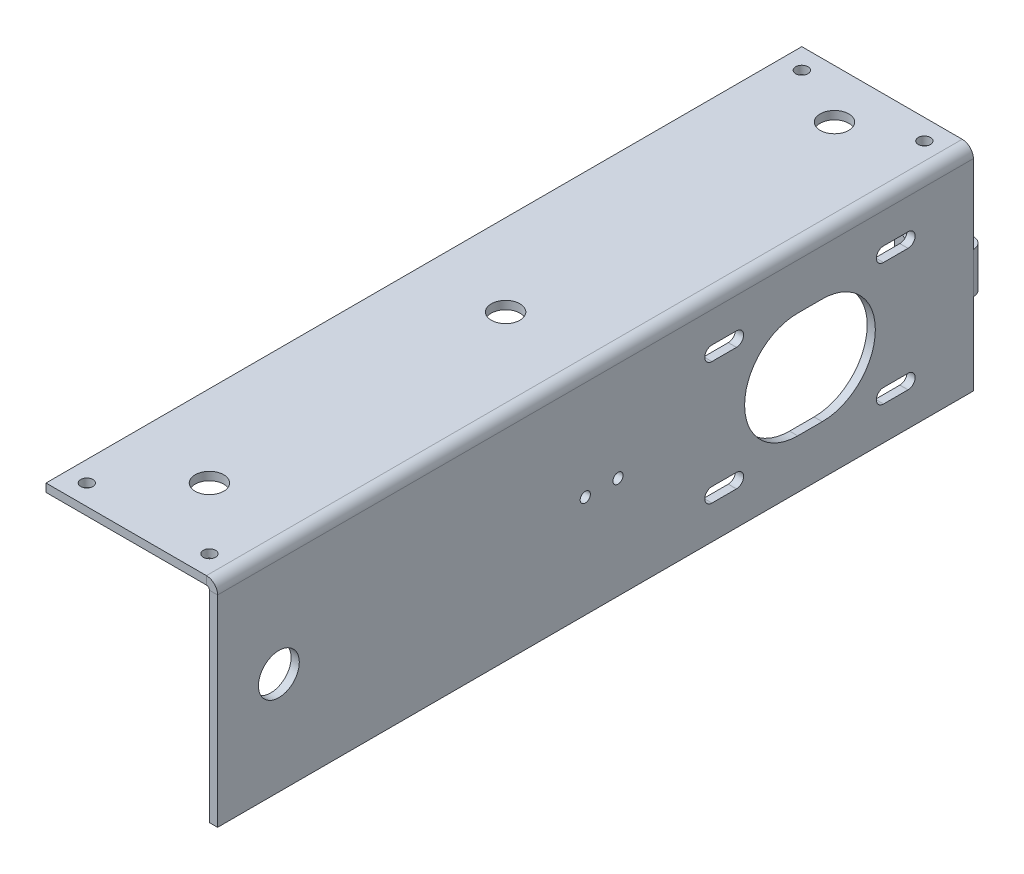
from build123d import *

# Parameters (mm, degrees)
SM_BASE_FLANGE_1_DEPTH    = 185
CUT_EXTRUDE_1_REACH       = 197.768
SKETCH_6_R                = 5
SM_EDGE_FLANGE_1_DEPTH    = 49.2634
HOLE_WIZARD_M3_2_D        = 3
CUT_EXTRUDE_START         = -2.7366
CUT_EXTRUDE_6_OUTLINE_W   = 21
CUT_EXTRUDE_6_OUTLINE_H   = 20
CUT_EXTRUDE_6_OUTLINE_H_2 = 19.2634
CUT_EXTRUDE_6_DEPTH       = 2.7366
HOLE_WIZARD_3_5_3_5_1_D   = 3.5
HOLE_WIZARD_7_0_7_1_D     = 7
HOLE_WIZARD_7_0_7_1_DEPTH = 6
HOLE_WIZARD_7_0_7_1_TIP   = 2.103012167
M3X0_5_1_D                = 2.5


# Read off the part's stored shape, not the designer's step: 除料-伸長6
# Sheet-metal steps are written as plain solids
with BuildPart() as part:
    # Sketch 1 → 基材-凸緣1 (new body)
    with BuildSketch(Plane.XY):
        with BuildLine():
            Line((0, -50), (0, -0.7366))
            ThreePointArc((0, -0.7366), (-0.215745145, -0.215745145), (-0.7366, 0))
            Line((-0.7366, 0), (-40, 0))
            Line((-40, 0), (-40, 2))
            Line((-40, 2), (-0.7366, 2))
            ThreePointArc((-0.7366, 2), (1.198468417, 1.198468417), (2, -0.7366))
            Line((2, -0.7366), (2, -50))
            Line((2, -50), (0, -50))
        make_face()
    extrude(amount=SM_BASE_FLANGE_1_DEPTH)

    # 草圖6 → 除料-伸長1 (cut, up to next)
    with BuildSketch(Plane.ZY, mode=Mode.PRIVATE) as cut_extrude_1_sk1:
        with Locations(Location((170, -25, 0), (0, 0, 270))):
            Circle(SKETCH_6_R)
    cut_extrude_1_tool1 = extrude(cut_extrude_1_sk1.sketch, amount=-CUT_EXTRUDE_1_REACH, mode=Mode.PRIVATE) & part.part
    # 草圖6 → 除料-伸長1 (cut, up to next)
    with BuildSketch(Plane.ZY, mode=Mode.PRIVATE) as cut_extrude_1_sk2:
        with BuildLine():
            Line((37, -12), (43, -12))
            ThreePointArc((43, -12), (56, -25), (43, -38))
            Line((43, -38), (37, -38))
            ThreePointArc((37, -38), (24, -25), (37, -12))
        make_face()
    cut_extrude_1_tool2 = extrude(cut_extrude_1_sk2.sketch, amount=-CUT_EXTRUDE_1_REACH, mode=Mode.PRIVATE) & part.part
    # 草圖6 → 除料-伸長1 (cut, up to next)
    with BuildSketch(Plane.ZY, mode=Mode.PRIVATE) as cut_extrude_1_sk3:
        with BuildLine():
            Line((58, -8.25), (64, -8.25))
            ThreePointArc((64, -8.25), (65.75, -10), (64, -11.75))
            Line((64, -11.75), (58, -11.75))
            ThreePointArc((58, -11.75), (56.25, -10), (58, -8.25))
        make_face()
    cut_extrude_1_tool3 = extrude(cut_extrude_1_sk3.sketch, amount=-CUT_EXTRUDE_1_REACH, mode=Mode.PRIVATE) & part.part
    # 草圖6 → 除料-伸長1 (cut, up to next)
    with BuildSketch(Plane.ZY, mode=Mode.PRIVATE) as cut_extrude_1_sk4:
        with BuildLine():
            Line((16, -8.25), (22, -8.25))
            ThreePointArc((22, -8.25), (23.75, -10), (22, -11.75))
            Line((22, -11.75), (16, -11.75))
            ThreePointArc((16, -11.75), (14.25, -10), (16, -8.25))
        make_face()
    cut_extrude_1_tool4 = extrude(cut_extrude_1_sk4.sketch, amount=-CUT_EXTRUDE_1_REACH, mode=Mode.PRIVATE) & part.part
    # 草圖6 → 除料-伸長1 (cut, up to next)
    with BuildSketch(Plane.ZY, mode=Mode.PRIVATE) as cut_extrude_1_sk5:
        with BuildLine():
            Line((16, -38.25), (22, -38.25))
            ThreePointArc((22, -38.25), (23.75, -40), (22, -41.75))
            Line((22, -41.75), (16, -41.75))
            ThreePointArc((16, -41.75), (14.25, -40), (16, -38.25))
        make_face()
    cut_extrude_1_tool5 = extrude(cut_extrude_1_sk5.sketch, amount=-CUT_EXTRUDE_1_REACH, mode=Mode.PRIVATE) & part.part
    # 草圖6 → 除料-伸長1 (cut, up to next)
    with BuildSketch(Plane.ZY, mode=Mode.PRIVATE) as cut_extrude_1_sk6:
        with BuildLine():
            Line((58, -38.25), (64, -38.25))
            ThreePointArc((64, -38.25), (65.75, -40), (64, -41.75))
            Line((64, -41.75), (58, -41.75))
            ThreePointArc((58, -41.75), (56.25, -40), (58, -38.25))
        make_face()
    cut_extrude_1_tool6 = extrude(cut_extrude_1_sk6.sketch, amount=-CUT_EXTRUDE_1_REACH, mode=Mode.PRIVATE) & part.part
    add(cut_extrude_1_tool1.solids().sort_by_distance((0, -25, 170))[0], mode=Mode.SUBTRACT)
    add(cut_extrude_1_tool2.solids().sort_by_distance((0, -25, 40))[0], mode=Mode.SUBTRACT)
    add(cut_extrude_1_tool3.solids().sort_by_distance((0, -10, 61))[0], mode=Mode.SUBTRACT)
    add(cut_extrude_1_tool4.solids().sort_by_distance((0, -10, 19))[0], mode=Mode.SUBTRACT)
    add(cut_extrude_1_tool5.solids().sort_by_distance((0, -40, 19))[0], mode=Mode.SUBTRACT)
    add(cut_extrude_1_tool6.solids().sort_by_distance((0, -40, 61))[0], mode=Mode.SUBTRACT)

    # 邊線-凸緣1 section (across the edge) → 邊線-凸緣1 (add)
    with BuildSketch(Plane(origin=(0, -0.7366, -0.7366), x_dir=(0, 0, 1), z_dir=(0, -1, 0))):
        with BuildLine():
            Line((-2, 0.7366), (-2, 18))
            Line((-2, 18), (0, 18))
            Line((0, 18), (0, 0.7366))
            ThreePointArc((0, 0.7366), (0.215745145, 0.215745145), (0.7366, 0))
            Line((0.7366, 0), (0.7366, -2))
            ThreePointArc((0.7366, -2), (-1.198468417, -1.198468417), (-2, 0.7366))
        make_face()
    extrude(amount=SM_EDGE_FLANGE_1_DEPTH)

    # M3 螺紋孔2 (through all)
    with Locations(Plane(origin=(0, 0, 0), x_dir=(-1, 0, 0), z_dir=(0, -1, 0))):
        with Locations((35, -5), (35, -180), (5, -5), (5, -180)):
            Hole(HOLE_WIZARD_M3_2_D / 2)

    # 除料-伸長6 outline → 除料-伸長6 (cut)
    with BuildSketch(Plane(origin=(0, 0, -2.7366), x_dir=(-1, 0, 0), z_dir=(0, 0, -1)).offset(CUT_EXTRUDE_START)):
        with Locations((7.5, -40)):
            Rectangle(CUT_EXTRUDE_6_OUTLINE_W, CUT_EXTRUDE_6_OUTLINE_H)
        with Locations((7.5, -10.3683)):
            Rectangle(CUT_EXTRUDE_6_OUTLINE_W, CUT_EXTRUDE_6_OUTLINE_H_2)
    extrude(amount=CUT_EXTRUDE_6_DEPTH, mode=Mode.SUBTRACT)

    # Ø3.5 (3.5) 直徑孔1 (through all)
    with Locations(Plane(origin=(0, 0, -2.7366), x_dir=(-1, 0, 0), z_dir=(0, 0, -1))):
        with Locations((15, -25)):
            Hole(HOLE_WIZARD_3_5_3_5_1_D / 2)

    # Ø7.0 (7) 直徑孔1
    with Locations(Plane(origin=(0, 0, 0), x_dir=(-1, 0, 0), z_dir=(0, -1, 0))):
        with Locations((20, -165), (20, -92.5), (20, -12)):
            Hole(HOLE_WIZARD_7_0_7_1_D / 2, depth=HOLE_WIZARD_7_0_7_1_DEPTH)
            with Locations((0, 0, -(HOLE_WIZARD_7_0_7_1_DEPTH + HOLE_WIZARD_7_0_7_1_TIP / 2))):  # 118° drill point
                Cone(0, HOLE_WIZARD_7_0_7_1_D / 2, HOLE_WIZARD_7_0_7_1_TIP, mode=Mode.SUBTRACT)

    # M3x0.5 螺紋孔1 (through all)
    with Locations(Plane(origin=(2, 0, 0), x_dir=(0, 0, -1), z_dir=(1, 0, 0))):
        with Locations((-95, -25), (-87, -25)):
            Hole(M3X0_5_1_D / 2)


solid = part.part
